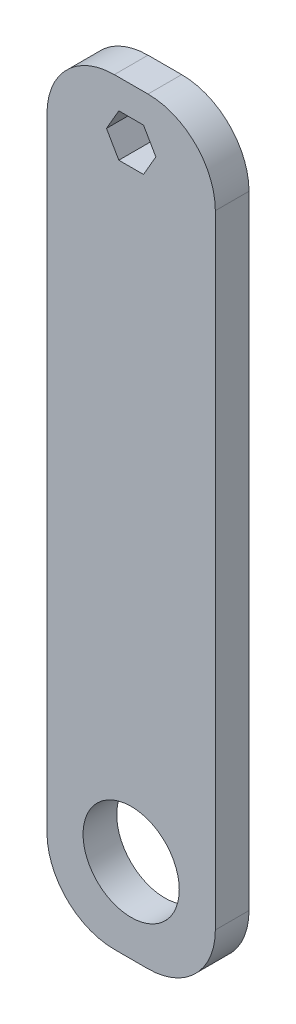
from build123d import *

# Parameters (mm, degrees)
SKETCH1_W           = 50
SKETCH1_H           = 10
BOSS_EXTRUDE1_DEPTH = 112.5
SKETCH2_R           = 14.2875
CUT_EXTRUDE1_DEPTH  = 127
FILLET1_R           = 20


with BuildPart() as part:
    # Sketch1 → Boss-Extrude1 (new, symmetric)
    with BuildSketch(Plane(origin=(0, 0, 0), x_dir=(1, 0, 0), z_dir=(0, 1, 0))):
        Rectangle(SKETCH1_W, SKETCH1_H)
    extrude(amount=BOSS_EXTRUDE1_DEPTH, both=True)

    # Sketch2 → Cut-Extrude1 (cut)
    with BuildSketch(Plane.XY.offset(5)):
        with Locations((0, -87.5)):
            Circle(SKETCH2_R)
        Polygon((3.666174209, 91.15), (7.332348419, 97.5), (3.666174209, 103.85), (-3.666174209, 103.85), (-7.332348419, 97.5), (-3.666174209, 91.15), align=None)
    extrude(amount=-CUT_EXTRUDE1_DEPTH, mode=Mode.SUBTRACT)

    # Fillet1
    fillet1_edges = [part.edges().sort_by_distance(p)[0] for p in [
        (-25, -112.5, 0),
        (25, -112.5, 0),
        (25, 112.5, 0),
        (-25, 112.5, 0),
    ]]
    fillet(fillet1_edges, radius=FILLET1_R)


solid = part.part
